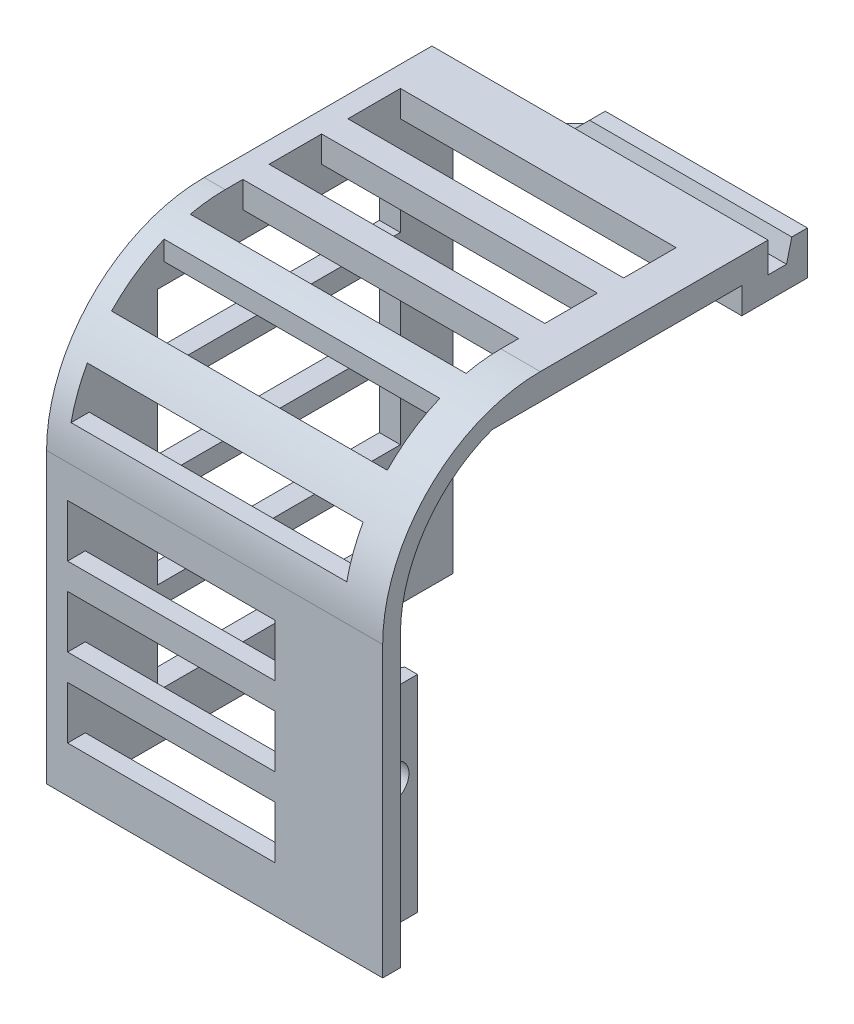
from build123d import *

# Parameters (mm, degrees)
BOSS_EXTRUDE1_DEPTH     = 25.6
SKETCH2_W               = 4.3
SKETCH2_H               = 15.7
CUT_EXTRUDE1_DEPTH      = 3
CUT_EXTRUDE2_REACH      = 52.281
SKETCH3_R               = 1.3
BOSS_EXTRUDE2_START     = -1.6
BOSS_EXTRUDE2_DEPTH     = 1.6
SKETCH6_W               = 20
SKETCH6_H               = 1.7
BOSS_EXTRUDE3_DEPTH     = 3
CHAMFER2_SIZE           = 3
BOSS_EXTRUDE5_DEPTH     = 17
CHAMFER3_SIZE           = 1.6
CUT_EXTRUDE3_REACH      = 52.926
SKETCH9_W               = 18.51367302
SKETCH9_H               = 5.5
LPATTERN1_COUNT         = 4
LPATTERN1_PITCH         = 7
CUT_EXTRUDE4_REACH      = 53.699
SKETCH10_W              = 21
SKETCH10_H              = 4
LPATTERN2_COUNT         = 4
LPATTERN2_PITCH         = 6
SKETCH11_W              = 4.3
SKETCH11_H              = 15.7
CUT_EXTRUDE5_DEPTH      = 20
CHAMFER4_SIZE           = 4.2
CUT_EXTRUDE6_REACH      = 54.653
SKETCH12_W              = 15.8
SKETCH12_H              = 4
LPATTERN3_COUNT         = 3
LPATTERN3_PITCH         = 6
CUT_EXTRUDE7_REACH      = 55.459
CUT_EXTRUDE7_END_RADIUS = 10.65
SKETCH13_W              = 21
SKETCH13_H              = 3.317301245


# Some blends are built 0.0001 mm under size
with BuildPart() as part:
    # Sketch1 → Boss-Extrude1 (new body)
    with BuildSketch(Plane(origin=(0, 0, 0), x_dir=(0, 0, -1), z_dir=(1, 0, 0))):
        with BuildLine():
            Line((-2, 32), (-2, 30))
            Line((-2, 30), (0, 30))
            Line((0, 30), (0, 34))
            Line((0, 34), (-17.35, 34))
            ThreePointArc((-17.35, 34), (-25.835281374, 30.485281374), (-29.35, 22))
            Line((-29.35, 22), (-29.35, 0))
            Line((-29.35, 0), (-23.7, 0))
            Line((-23.7, 0), (-23.7, 15.7))
            Line((-23.7, 15.7), (-28, 15.7))
            Line((-28, 15.7), (-28, 22))
            ThreePointArc((-28, 22), (-26.080424321, 28.099359898), (-21.01367302, 32))
            Line((-21.01367302, 32), (-2, 32))
        make_face()
    extrude(amount=-BOSS_EXTRUDE1_DEPTH)

    # Sketch2 → Cut-Extrude1 (cut)
    with BuildSketch(Plane(origin=(0, 0, 0), x_dir=(0, 0, -1), z_dir=(1, 0, 0))):
        with Locations((-25.85, 7.85)):
            Rectangle(SKETCH2_W, SKETCH2_H)
    extrude(amount=-CUT_EXTRUDE1_DEPTH, mode=Mode.SUBTRACT)

    # Sketch3 → Cut-Extrude2 (cut, up to next)
    with BuildSketch(Plane(origin=(-3, 0, 0), x_dir=(0, 0, -1), z_dir=(1, 0, 0)), mode=Mode.PRIVATE) as cut_extrude2_sk1:
        with Locations((-25.65, 9.5)):
            Circle(SKETCH3_R)
    cut_extrude2_tool1 = extrude(cut_extrude2_sk1.sketch, amount=-CUT_EXTRUDE2_REACH, mode=Mode.PRIVATE) & part.part
    add(cut_extrude2_tool1.solids().sort_by_distance((-3, 9.5, 25.65))[0], mode=Mode.SUBTRACT)

    # Sketch4 → Boss-Extrude2 (add)
    with BuildSketch(Plane.ZY.offset(25.6).offset(BOSS_EXTRUDE2_START)):
        with BuildLine():
            Line((0, 34), (0, 0))
            Line((0, 0), (29.35, 0))
            Line((29.35, 0), (29.35, 22))
            ThreePointArc((29.35, 22), (25.835281374, 30.485281374), (17.35, 34))
            Line((17.35, 34), (0, 34))
        make_face()
    extrude(amount=BOSS_EXTRUDE2_DEPTH)

    # Sketch6 → Boss-Extrude3 (add)
    with BuildSketch(Plane(origin=(0, 0, 0), x_dir=(-1, 0, 0), z_dir=(0, 0, -1))):
        with Locations((10, 30.85)):
            Rectangle(SKETCH6_W, SKETCH6_H)
    extrude(amount=BOSS_EXTRUDE3_DEPTH)

    # Chamfer2
    chamfer2_edges = [part.edges().sort_by_distance(p)[0] for p in [
        (-20, 30.85, -3),
    ]]
    chamfer(chamfer2_edges, length=CHAMFER2_SIZE - 0.0001)  # a hair under: the kernel refuses the full size

    # Sketch8 → Boss-Extrude5 (add)
    with BuildSketch(Plane.ZY):
        Polygon((-1.408034607, 31.7), (-1.808034607, 33.3), (-3, 33.3), (-3, 31.7), align=None)
    extrude(amount=BOSS_EXTRUDE5_DEPTH)

    # Chamfer3
    chamfer3_edges = [part.edges().sort_by_distance(p)[0] for p in [
        (-17, 33.3, -2.404017304),
    ]]
    chamfer(chamfer3_edges, length=CHAMFER3_SIZE - 0.0001)  # a hair under: the kernel refuses the full size

    # Sketch9 → Cut-Extrude3 (cut, up to next)
    with BuildSketch(Plane(origin=(-24, 0, 0), x_dir=(0, 0, -1), z_dir=(1, 0, 0)), mode=Mode.PRIVATE) as cut_extrude3_sk1:
        with Locations((-13.25683651, 27.25)):
            Rectangle(SKETCH9_W, SKETCH9_H)
    cut_extrude3_tool1 = extrude(cut_extrude3_sk1.sketch, amount=-CUT_EXTRUDE3_REACH, mode=Mode.PRIVATE) & part.part
    cut_extrude3 = cut_extrude3_tool1.solids().sort_by_distance((-24, 27.25, 13.256837))[0]
    add(cut_extrude3, mode=Mode.SUBTRACT)

    # LPattern1: Cut-Extrude3 ×4
    with Locations(*[(0, -i * LPATTERN1_PITCH, 0) for i in range(1, LPATTERN1_COUNT)]):
        add(cut_extrude3, mode=Mode.SUBTRACT)

    # Sketch10 → Cut-Extrude4 (cut, up to next)
    with BuildSketch(Plane(origin=(0, 34, 0), x_dir=(1, 0, 0), z_dir=(0, 1, 0)), mode=Mode.PRIVATE) as cut_extrude4_sk1:
        with Locations((-13.5, -6)):
            Rectangle(SKETCH10_W, SKETCH10_H)
    cut_extrude4_tool1 = extrude(cut_extrude4_sk1.sketch, amount=-CUT_EXTRUDE4_REACH, mode=Mode.PRIVATE) & part.part
    cut_extrude4 = cut_extrude4_tool1.solids().sort_by_distance((-13.5, 34, 6))[0]
    add(cut_extrude4, mode=Mode.SUBTRACT)

    # LPattern2: Cut-Extrude4; each copy of Cut-Extrude4 runs up to whatever stops it at its own place
    lpattern2_before = part.part  # the part as the pattern finds it: every copy runs up to it
    lpattern2_cut_extrude4_long = extrude(cut_extrude4_sk1.sketch, amount=-CUT_EXTRUDE4_REACH, mode=Mode.PRIVATE)
    lpattern2_cut_extrude4_tool1 = lpattern2_cut_extrude4_long.moved(Location(Vector(0, 0, 1) * (1 * LPATTERN2_PITCH))) & lpattern2_before
    add(lpattern2_cut_extrude4_tool1.solids().sort_by_distance((-13.5, 34, 12))[0], mode=Mode.SUBTRACT)
    lpattern2_cut_extrude4_tool2 = lpattern2_cut_extrude4_long.moved(Location(Vector(0, 0, 1) * (2 * LPATTERN2_PITCH))) & lpattern2_before
    add(lpattern2_cut_extrude4_tool2.solids().sort_by_distance((-13.5, 34, 18))[0], mode=Mode.SUBTRACT)
    lpattern2_cut_extrude4_tool3 = lpattern2_cut_extrude4_long.moved(Location(Vector(0, 0, 1) * (3 * LPATTERN2_PITCH))) & lpattern2_before
    add(lpattern2_cut_extrude4_tool3.solids().sort_by_distance((-13.5, 34, 24))[0], mode=Mode.SUBTRACT)

    # Sketch11 → Cut-Extrude5 (cut)
    with BuildSketch(Plane(origin=(-24, 0, 0), x_dir=(0, 0, -1), z_dir=(1, 0, 0))):
        with Locations((-25.85, 7.85)):
            Rectangle(SKETCH11_W, SKETCH11_H)
    extrude(amount=CUT_EXTRUDE5_DEPTH, mode=Mode.SUBTRACT)

    # Chamfer4
    # the kernel refuses this chamfer: 4.2 mm, written as the material it adds along each edge
    with BuildSketch(Plane(origin=(-4, 15.7, 28), x_dir=(-0.9996219169112966, 0, 0.02749587661058612), z_dir=(0, -1, 0))) as chamfer4_piece_1_section:
        Polygon((CHAMFER4_SIZE * 0.999621916911, CHAMFER4_SIZE * 0.0274958766106), (-CHAMFER4_SIZE * 0.0274958766106, CHAMFER4_SIZE * 0.999621916911), (0, 0), align=None)
    chamfer4_piece_1 = extrude(amount=15.7, mode=Mode.PRIVATE)
    chamfer4_piece_1 = chamfer4_piece_1 - Plane(origin=(-5.414149403, 9.5, 25.65), x_dir=(0, 0, -1), z_dir=(1, 0, 0)) * Cylinder(1.3, 49, mode=Mode.PRIVATE)
    add(chamfer4_piece_1)

    # Sketch12 → Cut-Extrude6 (cut, up to next)
    with BuildSketch(Plane(origin=(0, 0, 28), x_dir=(-1, 0, 0), z_dir=(0, 0, -1)), mode=Mode.PRIVATE) as cut_extrude6_sk1:
        with Locations((16.1, 5.5)):
            Rectangle(SKETCH12_W, SKETCH12_H)
    cut_extrude6_tool1 = extrude(cut_extrude6_sk1.sketch, amount=-CUT_EXTRUDE6_REACH, mode=Mode.PRIVATE) & part.part
    cut_extrude6 = cut_extrude6_tool1.solids().sort_by_distance((-16.1, 5.5, 28))[0]
    add(cut_extrude6, mode=Mode.SUBTRACT)

    # LPattern3: Cut-Extrude6 ×3
    with Locations(*[(0, i * LPATTERN3_PITCH, 0) for i in range(1, LPATTERN3_COUNT)]):
        add(cut_extrude6, mode=Mode.SUBTRACT)

    # Cut-Extrude7: up to this cylinder (the profile starts outside it)
    cut_extrude7_end = Plane(origin=(-13.5, 22, 17.35), z_dir=(1, 0, 0)) * Cylinder(CUT_EXTRUDE7_END_RADIUS, 133.218, mode=Mode.PRIVATE)
    # Sketch13 → Cut-Extrude7 (cut, up to the surface)
    with BuildSketch(Plane.XY.offset(29.35), mode=Mode.PRIVATE) as cut_extrude7_sk1:
        with Locations((-13.5, 26.158650623)):
            Rectangle(SKETCH13_W, SKETCH13_H)
    cut_extrude7_tool1 = extrude(cut_extrude7_sk1.sketch, amount=-CUT_EXTRUDE7_REACH, mode=Mode.PRIVATE) - cut_extrude7_end
    add(cut_extrude7_tool1.solids().sort_by_distance((-13.5, 26.158651, 29.35))[0], mode=Mode.SUBTRACT)


solid = part.part
